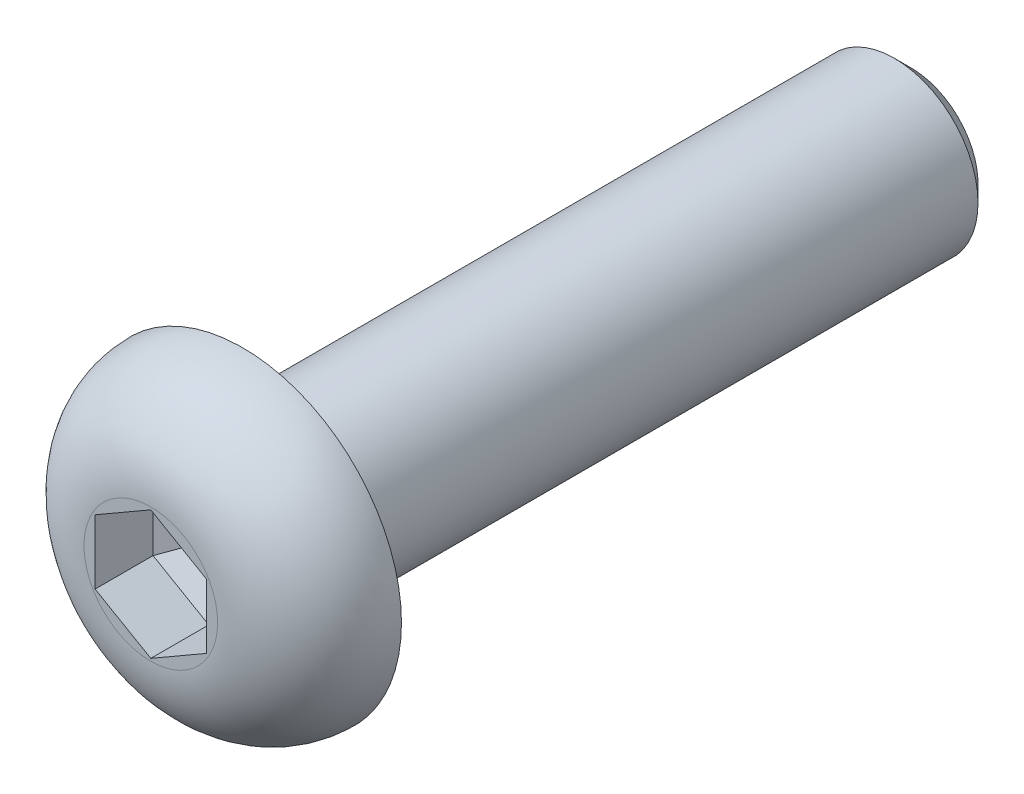
from build123d import *
from OCP.BRepFilletAPI import BRepFilletAPI_MakeChamfer

# Parameters (mm, degrees)
SKETCH_1_R          = 2.85
EXTRUDE_1_DEPTH     = 1.65
FILLET_1_R          = 1.65
SKETCH_3_R          = 1.5
EXTRUDE_3_DEPTH     = 12
CUT_EXTRUDE_1_DEPTH = 1.616368876
CHAMFER_2_SIZE      = 0.3
CHAMFER_3_SIZE      = 0.576368876
CHAMFER_3_SIZE2     = 0.998300177
FILLET_2_R          = 0.1


with BuildPart() as part:
    # 草图1 → 凸台-拉伸1 (new body)
    with BuildSketch(Plane.XY):
        Circle(SKETCH_1_R)
    extrude(amount=EXTRUDE_1_DEPTH)

    # 圆角1
    fillet_1_edges = [part.edges().sort_by_distance(p)[0] for p in [
        (-2.85, 0, 1.65),
    ]]
    fillet(fillet_1_edges, radius=FILLET_1_R - 0.0001)  # a hair under: the kernel refuses the full size

    # 草图3 → 凸台-拉伸3 (add)
    with BuildSketch(Plane(origin=(0, 0, 0), x_dir=(-1, 0, 0), z_dir=(0, 0, -1))):
        with Locations(Location((0, 0, 0), (0, 0, 180))):
            Circle(SKETCH_3_R)
    extrude(amount=EXTRUDE_3_DEPTH)

    # 草图4 → 切除-拉伸1 (cut)
    with BuildSketch(Plane.XY.offset(1.65)):
        Polygon((1, 0.577350269), (0, 1.154700538), (-1, 0.577350269), (-1, -0.577350269), (0, -1.154700538), (1, -0.577350269), align=None)
    extrude(amount=-CUT_EXTRUDE_1_DEPTH, mode=Mode.SUBTRACT)

    # 倒角2
    chamfer_2_edges = [part.edges().sort_by_distance(p)[0] for p in [
        (-1.5, 0, -12),
    ]]
    chamfer(chamfer_2_edges, length=CHAMFER_2_SIZE)

    # 倒角3: one chamfer whose edges measure the first distance from different faces: ONE call of the kernel's chamfer builder (chamfer() names one face for all edges)
    chamfer_3_edges_1 = [part.edges().sort_by_distance(p)[0] for p in [
        (1, 0, 0.033631124),
    ]]
    chamfer_3_side_1 = [part.faces().sort_by_distance(p)[0] for p in [
        (1, 0, 0.841815562),
    ]]
    chamfer_3_edges_2 = [part.edges().sort_by_distance(p)[0] for p in [
        (0.5, -0.866025404, 0.033631124),
    ]]
    chamfer_3_side_2 = [part.faces().sort_by_distance(p)[0] for p in [
        (0.5, -0.866025404, 0.841815562),
    ]]
    chamfer_3_edges_3 = [part.edges().sort_by_distance(p)[0] for p in [
        (-0.5, -0.866025404, 0.033631124),
    ]]
    chamfer_3_side_3 = [part.faces().sort_by_distance(p)[0] for p in [
        (-0.5, -0.866025404, 0.841815562),
    ]]
    chamfer_3_edges_4 = [part.edges().sort_by_distance(p)[0] for p in [
        (-1, 0, 0.033631124),
    ]]
    chamfer_3_side_4 = [part.faces().sort_by_distance(p)[0] for p in [
        (-1, 0, 0.841815562),
    ]]
    chamfer_3_edges_5 = [part.edges().sort_by_distance(p)[0] for p in [
        (-0.5, 0.866025404, 0.033631124),
    ]]
    chamfer_3_side_5 = [part.faces().sort_by_distance(p)[0] for p in [
        (-0.5, 0.866025404, 0.841815562),
    ]]
    chamfer_3_edges_6 = [part.edges().sort_by_distance(p)[0] for p in [
        (0.5, 0.866025404, 0.033631124),
    ]]
    chamfer_3_side_6 = [part.faces().sort_by_distance(p)[0] for p in [
        (0.5, 0.866025404, 0.841815562),
    ]]
    chamfer_3 = BRepFilletAPI_MakeChamfer(part.part.solid().wrapped)
    for e in chamfer_3_edges_1:
        chamfer_3.Add(CHAMFER_3_SIZE, CHAMFER_3_SIZE2, e.wrapped, chamfer_3_side_1[0].wrapped)  # the first distance lies on this face
    for e in chamfer_3_edges_2:
        chamfer_3.Add(CHAMFER_3_SIZE, CHAMFER_3_SIZE2, e.wrapped, chamfer_3_side_2[0].wrapped)  # the first distance lies on this face
    for e in chamfer_3_edges_3:
        chamfer_3.Add(CHAMFER_3_SIZE, CHAMFER_3_SIZE2, e.wrapped, chamfer_3_side_3[0].wrapped)  # the first distance lies on this face
    for e in chamfer_3_edges_4:
        chamfer_3.Add(CHAMFER_3_SIZE, CHAMFER_3_SIZE2, e.wrapped, chamfer_3_side_4[0].wrapped)  # the first distance lies on this face
    for e in chamfer_3_edges_5:
        chamfer_3.Add(CHAMFER_3_SIZE, CHAMFER_3_SIZE2, e.wrapped, chamfer_3_side_5[0].wrapped)  # the first distance lies on this face
    for e in chamfer_3_edges_6:
        chamfer_3.Add(CHAMFER_3_SIZE, CHAMFER_3_SIZE2, e.wrapped, chamfer_3_side_6[0].wrapped)  # the first distance lies on this face
    add(Compound.cast(chamfer_3.Shape()), mode=Mode.REPLACE)

    # 圆角2
    fillet_2_edges = [part.edges().sort_by_distance(p)[0] for p in [
        (-1.5, 0, 0),
    ]]
    fillet(fillet_2_edges, radius=FILLET_2_R)


solid = part.part
